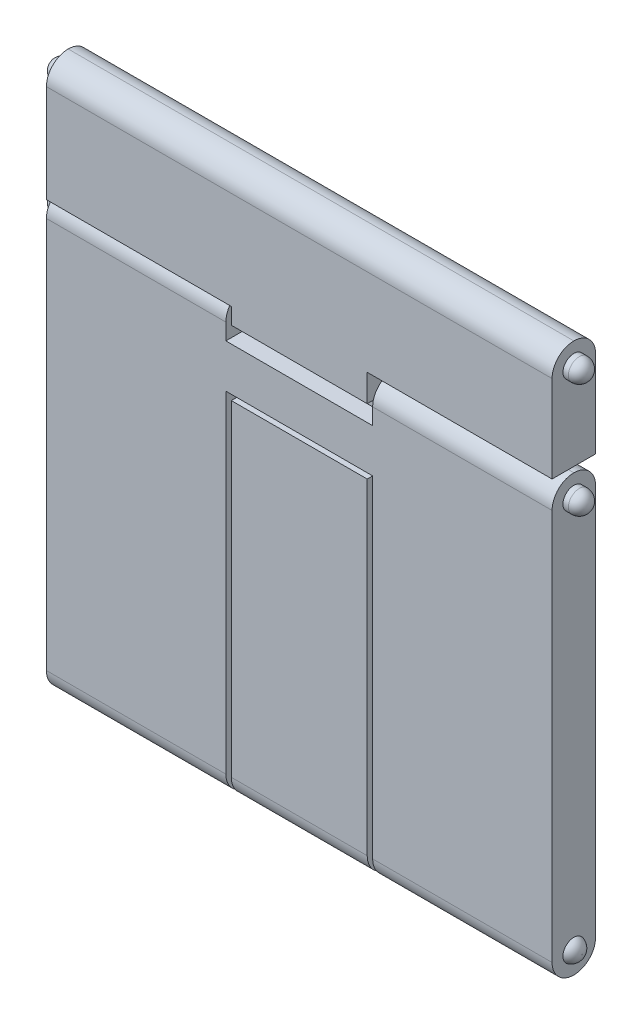
from build123d import *

# Parameters (mm, degrees)
SKETCH1_W             = 46.5
SKETCH1_H             = 50.5
BODY_DEPTH            = 4
BODY_CUT_DEPTH        = 4
FILLET1_R             = 2
FILLET2_R             = 2
FILLET3_R             = 2
HINGE_HOLE_L_START    = -6.5
SKETCH4_R             = 1.25
HINGE_HOLE_L_DEPTH    = 10
HINGE_HOLE_R_START    = -6.5
SKETCH8_R             = 1.25
HINGE_HOLE_R_DEPTH    = 10
HINGE_ROD_START       = 7
SKETCH7_R             = 0.9
HINGE_ROD_DEPTH       = 26.5
SKETCH9_W             = 12.5
SKETCH9_H             = 6
CONN_CUT_DEPTH        = 2
SKETCH10_W            = 1.5
SKETCH10_H            = 4
CONN_PIECE_DEPTH      = 13.5
SKETCH12_R            = 1
BUMPS_L_DEPTH         = 1.5
SKETCH13_R            = 1
BUMPS_R_DEPTH         = 1.5
SKETCH14_R            = 1
MINI_BUMP_L_DEPTH     = 0.75
SKETCH15_R            = 1
MINI_BUMP_R_DEPTH     = 0.75
FILLET6_R             = 1
FILLET7_R             = 1
FILLET8_R             = 1
HOOK_MATERIAL_R_DEPTH = 17


# Some blends are built 0.0001 mm under size
with BuildPart() as part:
    # Sketch1 → body (new body)
    with BuildSketch(Plane.XY):
        Rectangle(SKETCH1_W, SKETCH1_H)
    extrude(amount=BODY_DEPTH)

    # Sketch2 → body_cut (cut)
    with BuildSketch(Plane.XY.offset(4)):
        Polygon((-23.25, 15.25), (-6.25, 15.25), (-6.25, -25.25), (-6.75, -25.25), (-6.75, 14.75), (-23.25, 14.75), align=None)
        Polygon((6.25, 15.25), (23.25, 15.25), (23.25, 14.75), (6.75, 14.75), (6.75, -25.25), (6.25, -25.25), align=None)
    extrude(amount=-BODY_CUT_DEPTH, mode=Mode.SUBTRACT)


with BuildPart() as body_cut_piece_1:
    # of the separate pieces the step leaves, piece 1, a body of its own (body_cut_pieces)
    add(part.part.solids().sort_by_distance((6.25, -25.25, 0))[0])

    # Fillet3
    fillet3_edges = [body_cut_piece_1.edges().sort_by_distance(p)[0] for p in [
        (0, 25.25, 0),
        (0, 25.25, 4),
        (0, -25.25, 0),
        (0, -25.25, 4),
    ]]
    fillet(fillet3_edges, radius=FILLET3_R - 0.0001)  # a hair under: the kernel refuses the full size

    # Sketch7 → hinge_rod (add)
    with BuildSketch(Plane.ZY.offset(6.25).offset(HINGE_ROD_START)):
        with Locations(Location((2, -23.25, 0), (0, 0, 270))):
            Circle(SKETCH7_R)
    extrude(amount=-HINGE_ROD_DEPTH)

    # Sketch9 → conn_cut (cut)
    with BuildSketch(Plane.XY.offset(4)):
        with Locations((0, 9.75)):
            Rectangle(SKETCH9_W, SKETCH9_H)
    extrude(amount=-CONN_CUT_DEPTH, mode=Mode.SUBTRACT)



with BuildPart() as body_cut_piece_2:
    # of the separate pieces the step leaves, piece 2, a body of its own (body_cut_pieces)
    add(part.part.solids().sort_by_distance((-6.75, -25.25, 0))[0])

    # Fillet1
    fillet1_edges = [body_cut_piece_2.edges().sort_by_distance(p)[0] for p in [
        (-15, -25.25, 0),
        (-15, -25.25, 4),
        (-15, 14.75, 4),
        (-15, 14.75, 0),
    ]]
    fillet(fillet1_edges, radius=FILLET1_R - 0.0001)  # a hair under: the kernel refuses the full size

    # Sketch8 → hinge_hole_r (cut)
    with BuildSketch(Plane.ZY.offset(23.25).offset(HINGE_HOLE_R_START)):
        with Locations(Location((2, -23.25, 0), (0, 0, 180))):
            Circle(SKETCH8_R)
    extrude(amount=-HINGE_HOLE_R_DEPTH, mode=Mode.SUBTRACT)



with BuildPart() as body_cut_piece_3:
    # of the separate pieces the step leaves, piece 3, a body of its own (body_cut_pieces)
    add(part.part.solids().sort_by_distance((23.25, -25.25, 0))[0])

    # Fillet2
    fillet2_edges = [body_cut_piece_3.edges().sort_by_distance(p)[0] for p in [
        (15, 14.75, 0),
        (15, -25.25, 0),
        (15, -25.25, 4),
        (15, 14.75, 4),
    ]]
    fillet(fillet2_edges, radius=FILLET2_R - 0.0001)  # a hair under: the kernel refuses the full size

    # Sketch4 → hinge_hole_l (cut)
    with BuildSketch(Plane(origin=(23.25, 0, 0), x_dir=(0, 0, -1), z_dir=(1, 0, 0)).offset(HINGE_HOLE_L_START)):
        with Locations((-2, -23.25)):
            Circle(SKETCH4_R)
    extrude(amount=-HINGE_HOLE_L_DEPTH, mode=Mode.SUBTRACT)


with BuildPart() as body_cut_piece_2_1:
    add(body_cut_piece_2.part)

    add(body_cut_piece_3.part)  # conn_piece merges body_cut piece 3
    # Sketch10 → conn_piece (add)
    with BuildSketch(Plane(origin=(-6.75, 0, 0), x_dir=(0, 0, -1), z_dir=(1, 0, 0))):
        with Locations((-3.25, 9.25)):
            Rectangle(SKETCH10_W, SKETCH10_H)
    extrude(amount=CONN_PIECE_DEPTH)


with BuildPart() as body_cut_piece_1_1:
    add(body_cut_piece_1.part)

    add(body_cut_piece_2_1.part)  # bumps_l merges body_cut piece 2
    # Sketch12 → bumps_l (add)
    with BuildSketch(Plane(origin=(23.25, 0, 0), x_dir=(0, 0, -1), z_dir=(1, 0, 0))):
        with Locations(Location((-2, 23.25, 0), (0, 0, 180))):
            Circle(SKETCH12_R)
        with Locations(Location((-2, 12.75, 0), (0, 0, 180))):
            Circle(SKETCH12_R)
    extrude(amount=BUMPS_L_DEPTH)

    # Sketch13 → bumps_r (add)
    with BuildSketch(Plane.ZY.offset(23.25)):
        with Locations((2, 23.25)):
            Circle(SKETCH13_R)
        with Locations((2, 12.75)):
            Circle(SKETCH13_R)
    extrude(amount=BUMPS_R_DEPTH)

    # Sketch14 → mini_bump_l (add)
    with BuildSketch(Plane(origin=(23.25, 0, 0), x_dir=(0, 0, -1), z_dir=(1, 0, 0))):
        with Locations(Location((-2, -23.25, 0), (0, 0, 180))):
            Circle(SKETCH14_R)
    extrude(amount=MINI_BUMP_L_DEPTH)

    # Sketch15 → mini_bump_r (add)
    with BuildSketch(Plane.ZY.offset(23.25)):
        with Locations((2, -23.25)):
            Circle(SKETCH15_R)
    extrude(amount=MINI_BUMP_R_DEPTH)

    # Fillet6
    fillet6_edges = [body_cut_piece_1_1.edges().sort_by_distance(p)[0] for p in [
        (24.75, 23.25, 1),
        (-24.75, 23.25, 1),
    ]]
    fillet(fillet6_edges, radius=FILLET6_R)

    # Fillet7
    # the kernel refuses this fillet: 1 mm, written as the material it takes off along each edge
    with BuildSketch(Plane(origin=(-24.75, 12.75, 2), x_dir=(0, 0, 1), z_dir=(0, -1, 0))) as fillet7_piece_1:
        with BuildLine():
            CenterArc((1 - FILLET7_R, -FILLET7_R), FILLET7_R, 0, 90)
            Line((1 - FILLET7_R, 0), (1 - FILLET7_R, FILLET7_R * 0.02))
            Line((1 - FILLET7_R, FILLET7_R * 0.02), (1, FILLET7_R * 0.02))
            Line((1, FILLET7_R * 0.02), (1 + FILLET7_R * 0.02, 0))
            Line((1 + FILLET7_R * 0.02, 0), (1 + FILLET7_R * 0.02, -FILLET7_R))
            Line((1 + FILLET7_R * 0.02, -FILLET7_R), (1, -FILLET7_R))
        make_face()
    revolve(axis=Axis((-24.75, 12.75, 2), (-1, 0, 0)), mode=Mode.SUBTRACT)
    with BuildSketch(Plane(origin=(-24, -23.25, 2), x_dir=(0, 0, 1), z_dir=(0, -1, 0))) as fillet7_piece_2:
        with BuildLine():
            CenterArc((0.031754163, -1), FILLET7_R, 14.477512186, 75.522487814)
            Line((0.031754163, 0), (0.031754163, 0.02))
            Line((0.031754163, 0.02), (1, 0.02))
            Line((1, 0.02), (1.02, 0))
            ThreePointArc((1.02, 0), (1.02, -0.375), (1.019364917, -0.745))
            Line((1.019364917, -0.745), (1, -0.75))
        make_face()
    revolve(axis=Axis((-24, -23.25, 2), (-1, 0, 0)), mode=Mode.SUBTRACT)

    # Fillet8
    # the kernel refuses this fillet: 1 mm, written as the material it takes off along each edge
    with BuildSketch(Plane(origin=(24.75, 12.75, 2), x_dir=(0, 0, 1), z_dir=(0, 1, 0))) as fillet8_piece_1:
        with BuildLine():
            CenterArc((1 - FILLET8_R, -FILLET8_R), FILLET8_R, 0, 90)
            Line((1 - FILLET8_R, 0), (1 - FILLET8_R, FILLET8_R * 0.02))
            Line((1 - FILLET8_R, FILLET8_R * 0.02), (1, FILLET8_R * 0.02))
            Line((1, FILLET8_R * 0.02), (1 + FILLET8_R * 0.02, 0))
            Line((1 + FILLET8_R * 0.02, 0), (1 + FILLET8_R * 0.02, -FILLET8_R))
            Line((1 + FILLET8_R * 0.02, -FILLET8_R), (1, -FILLET8_R))
        make_face()
    revolve(axis=Axis((24.75, 12.75, 2), (1, 0, 0)), mode=Mode.SUBTRACT)
    with BuildSketch(Plane(origin=(24, -23.25, 2), x_dir=(0, 0, 1), z_dir=(0, 1, 0))) as fillet8_piece_2:
        with BuildLine():
            CenterArc((0.031754163, -1), FILLET8_R, 14.477512186, 75.522487814)
            Line((0.031754163, 0), (0.031754163, 0.02))
            Line((0.031754163, 0.02), (1, 0.02))
            Line((1, 0.02), (1.02, 0))
            ThreePointArc((1.02, 0), (1.02, -0.375), (1.019364917, -0.745))
            Line((1.019364917, -0.745), (1, -0.75))
        make_face()
    revolve(axis=Axis((24, -23.25, 2), (1, 0, 0)), mode=Mode.SUBTRACT)

    # Sketch16 → hook_material_r (add)
    with BuildSketch(Plane.ZY.offset(23.25)):
        with BuildLine():
            Line((0, 14.25), (0, 15.75))
            Line((0, 15.75), (4, 15.75))
            Line((4, 15.75), (4, 14.25))
            ThreePointArc((4, 14.25), (2, 15.25), (0, 14.25))
        make_face()
    extrude(amount=-HOOK_MATERIAL_R_DEPTH)


solid = body_cut_piece_1_1.part
